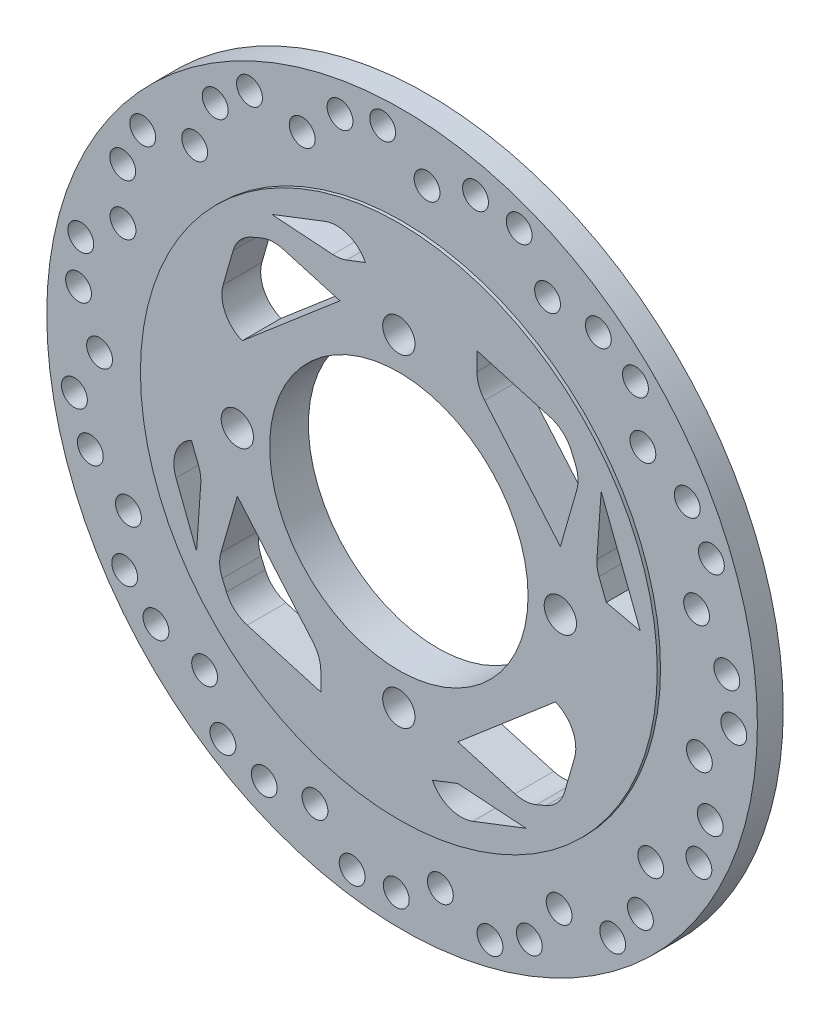
from build123d import *

# Parameters (mm, degrees)
BOSS_EXTRUDE3_DEPTH      = 2
BOSS_EXTRUDE3_DEPTH_BACK = 10
SKETCH1_R                = 80
SKETCH1_R_2              = 40
SKETCH1_R_3              = 5
BOSS_EXTRUDE4_DEPTH      = 1
BOSS_EXTRUDE4_DEPTH_BACK = 7
SKETCH1_6_R              = 110
SKETCH1_6_R_2            = 4
SKETCH1_6_R_3            = 80
FILLET1_R                = 10


with BuildPart() as part:
    # Sketch1 → Boss-Extrude3 (new, two sides: drawn at the far end of the back side and taken through both)
    with BuildSketch(Plane.XY.offset(-BOSS_EXTRUDE3_DEPTH_BACK)):
        Circle(SKETCH1_R)
        Circle(SKETCH1_R_2, mode=Mode.SUBTRACT)
        with Locations((0, 50)):
            Circle(SKETCH1_R_3, mode=Mode.SUBTRACT)
        with Locations((50, 0)):
            Circle(SKETCH1_R_3, mode=Mode.SUBTRACT)
        with Locations((0, -50)):
            Circle(SKETCH1_R_3, mode=Mode.SUBTRACT)
        with Locations((-50, 0)):
            Circle(SKETCH1_R_3, mode=Mode.SUBTRACT)
        Polygon((-39.35287908, 62.61788604), (-7.982530522, 74.729223141), (-10.365088641, 64.206258119), (-18.238023599, 61.166707281), align=None, mode=Mode.SUBTRACT)
        Polygon((-39.35287908, 56.065851214), (-18.238023599, 50), (-48.486018534, 24.166768812), (-57.852052568, 24.166768812), (-50, 51.499281488), align=None, mode=Mode.SUBTRACT)
        Polygon((62.61788604, 39.35287908), (61.166707281, 18.238023599), (64.206258119, 10.365088641), (74.729223141, 7.982530522), align=None, mode=Mode.SUBTRACT)
        Polygon((24.166768812, 48.486018534), (50, 18.238023599), (56.065851214, 39.35287908), (51.499281488, 50), (24.166768812, 57.852052568), align=None, mode=Mode.SUBTRACT)
        Polygon((39.35287908, -62.61788604), (18.238023599, -61.166707281), (10.365088641, -64.206258119), (7.982530522, -74.729223141), align=None, mode=Mode.SUBTRACT)
        Polygon((48.486018534, -24.166768812), (18.238023599, -50), (39.35287908, -56.065851214), (50, -51.499281488), (57.852052568, -24.166768812), align=None, mode=Mode.SUBTRACT)
        Polygon((-62.61788604, -39.35287908), (-61.166707281, -18.238023599), (-64.206258119, -10.365088641), (-74.729223141, -7.982530522), align=None, mode=Mode.SUBTRACT)
        Polygon((-24.166768812, -48.486018534), (-50, -18.238023599), (-56.065851214, -39.35287908), (-51.499281488, -50), (-24.166768812, -57.852052568), align=None, mode=Mode.SUBTRACT)
    extrude(amount=BOSS_EXTRUDE3_DEPTH + BOSS_EXTRUDE3_DEPTH_BACK)

    # Sketch1<6> → Boss-Extrude4 (add, two sides: drawn at the far end of the back side and taken through both)
    with BuildSketch(Plane.XY.offset(-BOSS_EXTRUDE4_DEPTH_BACK)):
        Circle(SKETCH1_6_R)
        with Locations((-55.461874175, -86.562163177)):
            Circle(SKETCH1_6_R_2, mode=Mode.SUBTRACT)
        with Locations((-85.874946892, -56.520094454)):
            Circle(SKETCH1_6_R_2, mode=Mode.SUBTRACT)
        with Locations((-61.121235607, -70.984024865)):
            Circle(SKETCH1_6_R_2, mode=Mode.SUBTRACT)
        with Locations((-76.185331155, -66.178118816)):
            Circle(SKETCH1_6_R_2, mode=Mode.SUBTRACT)
        with Locations((-42.681697323, -91.444085685)):
            Circle(SKETCH1_6_R_2, mode=Mode.SUBTRACT)
        with Locations((-15.458939556, -101.636847495)):
            Circle(SKETCH1_6_R_2, mode=Mode.SUBTRACT)
        with Locations((-1.798010273, -100.898539396)):
            Circle(SKETCH1_6_R_2, mode=Mode.SUBTRACT)
        with Locations((-26.965223169, -89.707379672)):
            Circle(SKETCH1_6_R_2, mode=Mode.SUBTRACT)
        with Locations((-96.515829108, -29.469353994)):
            Circle(SKETCH1_6_R_2, mode=Mode.SUBTRACT)
        with Locations((-84.70883114, -39.986887289)):
            Circle(SKETCH1_6_R_2, mode=Mode.SUBTRACT)
        with Locations((-101.439461143, -16.70518793)):
            Circle(SKETCH1_6_R_2, mode=Mode.SUBTRACT)
        with Locations((-93.649500213, -2.075653632)):
            Circle(SKETCH1_6_R_2, mode=Mode.SUBTRACT)
        with Locations((27.216986151, -99.137597538)):
            Circle(SKETCH1_6_R_2, mode=Mode.SUBTRACT)
        with Locations((11.853321327, -92.919513568)):
            Circle(SKETCH1_6_R_2, mode=Mode.SUBTRACT)
        with Locations((39.396569088, -92.906719011)):
            Circle(SKETCH1_6_R_2, mode=Mode.SUBTRACT)
        with Locations((48.622318881, -80.06501942)):
            Circle(SKETCH1_6_R_2, mode=Mode.SUBTRACT)
        with Locations((65.186847694, -79.496556331)):
            Circle(SKETCH1_6_R_2, mode=Mode.SUBTRACT)
        with Locations((73.779123746, -68.850482877)):
            Circle(SKETCH1_6_R_2, mode=Mode.SUBTRACT)
        with Locations((76.984075781, -53.366556047)):
            Circle(SKETCH1_6_R_2, mode=Mode.SUBTRACT)
        with Locations((91.885311068, -46.109838331)):
            Circle(SKETCH1_6_R_2, mode=Mode.SUBTRACT)
        with Locations((95.404597647, -32.889372768)):
            Circle(SKETCH1_6_R_2, mode=Mode.SUBTRACT)
        with Locations((92.0345866, -17.440530314)):
            Circle(SKETCH1_6_R_2, mode=Mode.SUBTRACT)
        with Locations((102.695969405, -4.750310388)):
            Circle(SKETCH1_6_R_2, mode=Mode.SUBTRACT)
        with Locations((-100.157863389, 12.334929854)):
            Circle(SKETCH1_6_R_2, mode=Mode.SUBTRACT)
        with Locations((-99.464171014, 25.998197348)):
            Circle(SKETCH1_6_R_2, mode=Mode.SUBTRACT)
        with Locations((-86.397319921, 36.194479396)):
            Circle(SKETCH1_6_R_2, mode=Mode.SUBTRACT)
        with Locations((-86.481693185, 52.006392271)):
            Circle(SKETCH1_6_R_2, mode=Mode.SUBTRACT)
        with Locations((-80.290622113, 64.206258119)):
            Circle(SKETCH1_6_R_2, mode=Mode.SUBTRACT)
        with Locations((-64.206258119, 68.206258119)):
            Circle(SKETCH1_6_R_2, mode=Mode.SUBTRACT)
        with Locations((-57.852052568, 82.685477001)):
            Circle(SKETCH1_6_R_2, mode=Mode.SUBTRACT)
        with Locations((-47.234095231, 91.312473565)):
            Circle(SKETCH1_6_R_2, mode=Mode.SUBTRACT)
        with Locations((-30.913350993, 88.424555179)):
            Circle(SKETCH1_6_R_2, mode=Mode.SUBTRACT)
        with Locations((-19.219266492, 99.067491584)):
            Circle(SKETCH1_6_R_2, mode=Mode.SUBTRACT)
        with Locations((-6.010364175, 102.629932784)):
            Circle(SKETCH1_6_R_2, mode=Mode.SUBTRACT)
        Circle(SKETCH1_6_R_3, mode=Mode.SUBTRACT)
        with Locations((100.533749891, 8.758608684)):
            Circle(SKETCH1_6_R_2, mode=Mode.SUBTRACT)
        with Locations((91.171481287, 21.501121553)):
            Circle(SKETCH1_6_R_2, mode=Mode.SUBTRACT)
        with Locations((95.749561669, 37.430589376)):
            Circle(SKETCH1_6_R_2, mode=Mode.SUBTRACT)
        with Locations((88.279703458, 48.892147125)):
            Circle(SKETCH1_6_R_2, mode=Mode.SUBTRACT)
        with Locations((45.027181332, 82.140673052)):
            Circle(SKETCH1_6_R_2, mode=Mode.SUBTRACT)
        with Locations((7.724755359, 93.353443337)):
            Circle(SKETCH1_6_R_2, mode=Mode.SUBTRACT)
        with Locations((22.736705362, 98.319836872)):
            Circle(SKETCH1_6_R_2, mode=Mode.SUBTRACT)
        with Locations((36.252613449, 96.201744262)):
            Circle(SKETCH1_6_R_2, mode=Mode.SUBTRACT)
        with Locations((74.543998594, 56.725034172)):
            Circle(SKETCH1_6_R_2, mode=Mode.SUBTRACT)
        with Locations((60.761294302, 80.571789157)):
            Circle(SKETCH1_6_R_2, mode=Mode.SUBTRACT)
        with Locations((72.247184863, 73.13940019)):
            Circle(SKETCH1_6_R_2, mode=Mode.SUBTRACT)
    extrude(amount=BOSS_EXTRUDE4_DEPTH + BOSS_EXTRUDE4_DEPTH_BACK)

    # Fillet1
    # the kernel refuses this fillet: 10 mm, written as the material it adds along each edge
    with BuildSketch(Plane(origin=(61.166707281, 18.238023599, 0), x_dir=(0.36016574729150513, -0.9328883290501343, 0), z_dir=(0, 0, -1)), Plane(origin=(-61.166707281, -18.238023599, 0), x_dir=(-0.3601657472914985, 0.932888329050137, 0), z_dir=(0, 0, -1)), Plane(origin=(-18.238023599, 61.166707281, 0), x_dir=(0.9328883290501342, 0.3601657472915057, 0), z_dir=(0, 0, -1))) as fillet1_piece_1:
        with BuildLine():
            CenterArc((FILLET1_R * 0.222079309279, -FILLET1_R), FILLET1_R, 90, 25.042008993)
            Line((-FILLET1_R * 0.201203339373, -FILLET1_R * 0.0940023182422), (-FILLET1_R * 0.209668992346, -FILLET1_R * 0.075882364607))
            Line((-FILLET1_R * 0.209668992346, -FILLET1_R * 0.075882364607), (-FILLET1_R * 0.00444158618557, FILLET1_R * 0.02))
            Line((-FILLET1_R * 0.00444158618557, FILLET1_R * 0.02), (FILLET1_R * 0.222079309279, FILLET1_R * 0.02))
            Line((FILLET1_R * 0.222079309279, FILLET1_R * 0.02), (FILLET1_R * 0.222079309279, 0))
        make_face()
    extrude(amount=10)
    with BuildSketch(Plane(origin=(7.982530522, -74.729223141, 0), x_dir=(0.9328883290501362, 0.3601657472915002, 0), z_dir=(0, 0, -1)), Plane(origin=(-7.982530522, 74.729223141, 0), x_dir=(-0.9328883290501336, -0.3601657472915072, 0), z_dir=(0, 0, -1)), Plane(origin=(-74.729223141, -7.982530522, 0), x_dir=(0.36016574729149753, -0.9328883290501373, 0), z_dir=(0, 0, -1))) as fillet1_piece_2:
        with BuildLine():
            CenterArc((15.958302411, -10), FILLET1_R, 90, 84.022583564)
            Line((6.012672223, -8.958635431), (5.813759619, -8.93780814))
            ThreePointArc((5.813759619, -8.93780814), (2.8402712, -4.590773739), (-0.166064912, -0.111456023))
            Line((-0.166064912, -0.111456023), (0, 0.2))
            Line((0, 0.2), (15.958302411, 0.2))
            Line((15.958302411, 0.2), (15.958302411, 0))
        make_face()
    extrude(amount=10)
    with BuildSketch(Plane(origin=(-51.499281488, -50, 0), x_dir=(0.9611257296889827, -0.2761110858510039, 0), z_dir=(0, 0, -1)), Plane(origin=(51.499281488, 50, 0), x_dir=(-0.9611257296889844, 0.276111085850998, 0), z_dir=(0, 0, -1)), Plane(origin=(50, -51.499281488, 0), x_dir=(0.2761110858510002, 0.9611257296889839, 0), z_dir=(0, 0, -1)), Plane(origin=(-50, 51.499281488, 0), x_dir=(-0.27611108585099386, -0.9611257296889856, 0), z_dir=(0, 0, -1))) as fillet1_piece_3:
        with BuildLine():
            CenterArc((FILLET1_R * 0.474377058691, -FILLET1_R), FILLET1_R, 90, 50.757179371)
            Line((-FILLET1_R * 0.300094859609, -FILLET1_R * 0.367391710642), (-FILLET1_R * 0.315584297975, -FILLET1_R * 0.354739544855))
            Line((-FILLET1_R * 0.315584297975, -FILLET1_R * 0.354739544855), (-FILLET1_R * 0.00948754117383, FILLET1_R * 0.02))
            Line((-FILLET1_R * 0.00948754117383, FILLET1_R * 0.02), (FILLET1_R * 0.474377058691, FILLET1_R * 0.02))
            Line((FILLET1_R * 0.474377058691, FILLET1_R * 0.02), (FILLET1_R * 0.474377058691, 0))
        make_face()
    extrude(amount=10)
    with BuildSketch(Plane(origin=(-57.852052568, 24.166768812, 0), x_dir=(1, 0, 0), z_dir=(0, 0, -1)), Plane(origin=(57.852052568, -24.166768812, 0), x_dir=(-1, 0, 0), z_dir=(0, 0, -1))) as fillet1_piece_4:
        with BuildLine():
            CenterArc((13.072623037, -9.287690669), FILLET1_R, 111.756259106, 84.271979458)
            Line((3.46136574, -12.048801527), (3.269140594, -12.104023745))
            Line((3.269140594, -12.104023745), (-0.192225146, -0.055222217))
            Line((-0.192225146, -0.055222217), (0, 0.2))
            ThreePointArc((0, 0.2), (4.683017017, 0.2), (9.291902254, 0.185753813))
            Line((9.291902254, 0.185753813), (9.366034034, 0))
        make_face()
    extrude(amount=10)
    with BuildSketch(Plane(origin=(24.166768812, 48.486018534, 0), x_dir=(0, 1, 0), z_dir=(0, 0, -1)), Plane(origin=(-24.166768812, -48.486018534, 0), x_dir=(0, -1, 0), z_dir=(0, 0, -1))) as fillet1_piece_5:
        with BuildLine():
            CenterArc((FILLET1_R * 0.3689086501, FILLET1_R), FILLET1_R, 229.501092058, 40.498907942)
            Line((-FILLET1_R * 0.280524904775, FILLET1_R * 0.239581656058), (-FILLET1_R * 0.293513575872, FILLET1_R * 0.224373289179))
            Line((-FILLET1_R * 0.293513575872, FILLET1_R * 0.224373289179), (-FILLET1_R * 0.00737817300199, -FILLET1_R * 0.02))
            Line((-FILLET1_R * 0.00737817300199, -FILLET1_R * 0.02), (FILLET1_R * 0.3689086501, -FILLET1_R * 0.02))
            Line((FILLET1_R * 0.3689086501, -FILLET1_R * 0.02), (FILLET1_R * 0.3689086501, 0))
        make_face()
    extrude(amount=10)
    with BuildSketch(Plane(origin=(39.35287908, -56.065851214, 0), x_dir=(0.9190350492930653, 0.39417582139305946, 0), z_dir=(0, 0, -1)), Plane(origin=(56.065851214, 39.35287908, 0), x_dir=(-0.3941758213930612, 0.9190350492930646, 0), z_dir=(0, 0, -1)), Plane(origin=(-56.065851214, -39.35287908, 0), x_dir=(0.39417582139305507, -0.9190350492930671, 0), z_dir=(0, 0, -1))) as fillet1_piece_6:
        with BuildLine():
            CenterArc((FILLET1_R * 0.356505100381, -FILLET1_R), FILLET1_R, 90, 39.242820629)
            Line((-FILLET1_R * 0.276103188976, -FILLET1_R * 0.225528081699), (-FILLET1_R * 0.288755354763, -FILLET1_R * 0.210038643333))
            Line((-FILLET1_R * 0.288755354763, -FILLET1_R * 0.210038643333), (-FILLET1_R * 0.00713010200763, FILLET1_R * 0.02))
            Line((-FILLET1_R * 0.00713010200763, FILLET1_R * 0.02), (FILLET1_R * 0.356505100381, FILLET1_R * 0.02))
            Line((FILLET1_R * 0.356505100381, FILLET1_R * 0.02), (FILLET1_R * 0.356505100381, 0))
        make_face()
    extrude(amount=10)
    with BuildSketch(Plane(origin=(-39.35287908, 56.065851214, 0), x_dir=(0.9611257296889855, -0.27611108585099425, 0), z_dir=(0, 0, -1))) as fillet1_piece_7:
        with BuildLine():
            CenterArc((FILLET1_R * 0.356505100381, FILLET1_R), FILLET1_R, 230.757179371, 39.242820629)
            Line((-FILLET1_R * 0.276103188976, FILLET1_R * 0.225528081699), (-FILLET1_R * 0.288755354763, FILLET1_R * 0.210038643333))
            Line((-FILLET1_R * 0.288755354763, FILLET1_R * 0.210038643333), (-FILLET1_R * 0.00713010200763, -FILLET1_R * 0.02))
            Line((-FILLET1_R * 0.00713010200763, -FILLET1_R * 0.02), (FILLET1_R * 0.356505100381, -FILLET1_R * 0.02))
            Line((FILLET1_R * 0.356505100381, -FILLET1_R * 0.02), (FILLET1_R * 0.356505100381, 0))
        make_face()
    extrude(amount=10)
    with BuildSketch(Plane(origin=(-74.729223141, -7.982530522, 0), x_dir=(0.36016574729149753, -0.9328883290501373, 0), z_dir=(0, 0, 1)), Plane(origin=(-7.982530522, 74.729223141, 0), x_dir=(-0.9328883290501336, -0.3601657472915072, 0), z_dir=(0, 0, 1)), Plane(origin=(7.982530522, -74.729223141, 0), x_dir=(0.9328883290501362, 0.3601657472915002, 0), z_dir=(0, 0, 1))) as fillet1_piece_8:
        with BuildLine():
            CenterArc((15.958302411, 10), FILLET1_R, 185.977416436, 84.022583564)
            Line((6.012672223, 8.958635431), (5.813759619, 8.93780814))
            ThreePointArc((5.813759619, 8.93780814), (2.8402712, 4.590773739), (-0.166064912, 0.111456023))
            Line((-0.166064912, 0.111456023), (0, -0.2))
            Line((0, -0.2), (15.958302411, -0.2))
            Line((15.958302411, -0.2), (15.958302411, 0))
        make_face()
    extrude(amount=2)
    with BuildSketch(Plane(origin=(-24.166768812, -48.486018534, 0), x_dir=(0, -1, 0), z_dir=(0, 0, 1)), Plane(origin=(24.166768812, 48.486018534, 0), x_dir=(0, 1, 0), z_dir=(0, 0, 1))) as fillet1_piece_9:
        with BuildLine():
            CenterArc((FILLET1_R * 0.3689086501, -FILLET1_R), FILLET1_R, 90, 40.498907942)
            Line((-FILLET1_R * 0.280524904775, -FILLET1_R * 0.239581656058), (-FILLET1_R * 0.293513575872, -FILLET1_R * 0.224373289179))
            Line((-FILLET1_R * 0.293513575872, -FILLET1_R * 0.224373289179), (-FILLET1_R * 0.00737817300199, FILLET1_R * 0.02))
            Line((-FILLET1_R * 0.00737817300199, FILLET1_R * 0.02), (FILLET1_R * 0.3689086501, FILLET1_R * 0.02))
            Line((FILLET1_R * 0.3689086501, FILLET1_R * 0.02), (FILLET1_R * 0.3689086501, 0))
        make_face()
    extrude(amount=2)
    with BuildSketch(Plane(origin=(57.852052568, -24.166768812, 0), x_dir=(-1, 0, 0), z_dir=(0, 0, 1)), Plane(origin=(-57.852052568, 24.166768812, 0), x_dir=(1, 0, 0), z_dir=(0, 0, 1))) as fillet1_piece_10:
        with BuildLine():
            CenterArc((13.072623037, 9.287690669), FILLET1_R, 163.971761435, 84.271979458)
            Line((3.46136574, 12.048801527), (3.269140594, 12.104023745))
            Line((3.269140594, 12.104023745), (-0.192225146, 0.055222217))
            Line((-0.192225146, 0.055222217), (0, -0.2))
            ThreePointArc((0, -0.2), (4.683017017, -0.2), (9.291902254, -0.185753813))
            Line((9.291902254, -0.185753813), (9.366034034, 0))
        make_face()
    extrude(amount=2)
    with BuildSketch(Plane(origin=(-39.35287908, 56.065851214, 0), x_dir=(0.9611257296889855, -0.27611108585099425, 0), z_dir=(0, 0, 1))) as fillet1_piece_11:
        with BuildLine():
            CenterArc((FILLET1_R * 0.356505100381, -FILLET1_R), FILLET1_R, 90, 39.242820629)
            Line((-FILLET1_R * 0.276103188976, -FILLET1_R * 0.225528081699), (-FILLET1_R * 0.288755354763, -FILLET1_R * 0.210038643333))
            Line((-FILLET1_R * 0.288755354763, -FILLET1_R * 0.210038643333), (-FILLET1_R * 0.00713010200763, FILLET1_R * 0.02))
            Line((-FILLET1_R * 0.00713010200763, FILLET1_R * 0.02), (FILLET1_R * 0.356505100381, FILLET1_R * 0.02))
            Line((FILLET1_R * 0.356505100381, FILLET1_R * 0.02), (FILLET1_R * 0.356505100381, 0))
        make_face()
    extrude(amount=2)
    with BuildSketch(Plane(origin=(-50, 51.499281488, 0), x_dir=(-0.27611108585099386, -0.9611257296889856, 0), z_dir=(0, 0, 1)), Plane(origin=(50, -51.499281488, 0), x_dir=(0.2761110858510002, 0.9611257296889839, 0), z_dir=(0, 0, 1)), Plane(origin=(51.499281488, 50, 0), x_dir=(-0.9611257296889844, 0.276111085850998, 0), z_dir=(0, 0, 1)), Plane(origin=(-51.499281488, -50, 0), x_dir=(0.9611257296889827, -0.2761110858510039, 0), z_dir=(0, 0, 1))) as fillet1_piece_12:
        with BuildLine():
            CenterArc((FILLET1_R * 0.474377058691, FILLET1_R), FILLET1_R, 219.242820629, 50.757179371)
            Line((-FILLET1_R * 0.300094859609, FILLET1_R * 0.367391710642), (-FILLET1_R * 0.315584297975, FILLET1_R * 0.354739544855))
            Line((-FILLET1_R * 0.315584297975, FILLET1_R * 0.354739544855), (-FILLET1_R * 0.00948754117383, -FILLET1_R * 0.02))
            Line((-FILLET1_R * 0.00948754117383, -FILLET1_R * 0.02), (FILLET1_R * 0.474377058691, -FILLET1_R * 0.02))
            Line((FILLET1_R * 0.474377058691, -FILLET1_R * 0.02), (FILLET1_R * 0.474377058691, 0))
        make_face()
    extrude(amount=2)
    with BuildSketch(Plane(origin=(-56.065851214, -39.35287908, 0), x_dir=(0.39417582139305507, -0.9190350492930671, 0), z_dir=(0, 0, 1)), Plane(origin=(56.065851214, 39.35287908, 0), x_dir=(-0.3941758213930612, 0.9190350492930646, 0), z_dir=(0, 0, 1)), Plane(origin=(39.35287908, -56.065851214, 0), x_dir=(0.9190350492930653, 0.39417582139305946, 0), z_dir=(0, 0, 1))) as fillet1_piece_13:
        with BuildLine():
            CenterArc((FILLET1_R * 0.356505100381, FILLET1_R), FILLET1_R, 230.757179371, 39.242820629)
            Line((-FILLET1_R * 0.276103188976, FILLET1_R * 0.225528081699), (-FILLET1_R * 0.288755354763, FILLET1_R * 0.210038643333))
            Line((-FILLET1_R * 0.288755354763, FILLET1_R * 0.210038643333), (-FILLET1_R * 0.00713010200763, -FILLET1_R * 0.02))
            Line((-FILLET1_R * 0.00713010200763, -FILLET1_R * 0.02), (FILLET1_R * 0.356505100381, -FILLET1_R * 0.02))
            Line((FILLET1_R * 0.356505100381, -FILLET1_R * 0.02), (FILLET1_R * 0.356505100381, 0))
        make_face()
    extrude(amount=2)
    with BuildSketch(Plane(origin=(-18.238023599, 61.166707281, 0), x_dir=(0.9328883290501342, 0.3601657472915057, 0), z_dir=(0, 0, 1)), Plane(origin=(-61.166707281, -18.238023599, 0), x_dir=(-0.3601657472914985, 0.932888329050137, 0), z_dir=(0, 0, 1)), Plane(origin=(61.166707281, 18.238023599, 0), x_dir=(0.36016574729150513, -0.9328883290501343, 0), z_dir=(0, 0, 1))) as fillet1_piece_14:
        with BuildLine():
            CenterArc((FILLET1_R * 0.222079309279, FILLET1_R), FILLET1_R, 244.957991007, 25.042008993)
            Line((-FILLET1_R * 0.201203339373, FILLET1_R * 0.0940023182422), (-FILLET1_R * 0.209668992346, FILLET1_R * 0.075882364607))
            Line((-FILLET1_R * 0.209668992346, FILLET1_R * 0.075882364607), (-FILLET1_R * 0.00444158618557, -FILLET1_R * 0.02))
            Line((-FILLET1_R * 0.00444158618557, -FILLET1_R * 0.02), (FILLET1_R * 0.222079309279, -FILLET1_R * 0.02))
            Line((FILLET1_R * 0.222079309279, -FILLET1_R * 0.02), (FILLET1_R * 0.222079309279, 0))
        make_face()
    extrude(amount=2)


solid = part.part
